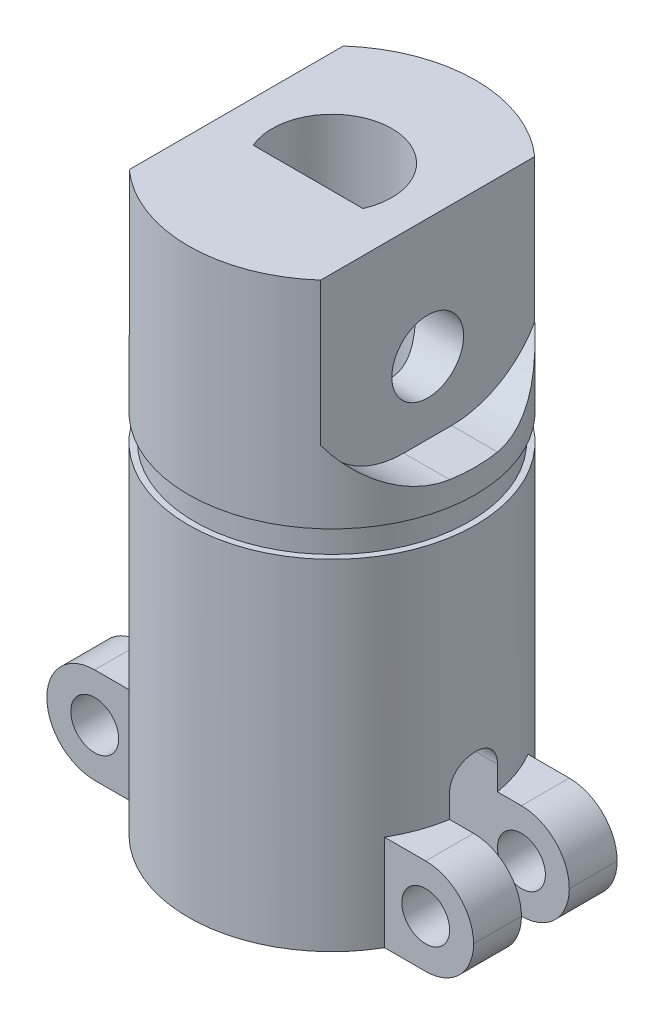
from build123d import *

# Parameters (mm, degrees)
CUT_EXTRUDE2_DEPTH  = 2
SKETCH4_R           = 1.5
CUT_EXTRUDE3_DEPTH  = 30.819624498
CUT_EXTRUDE4_DEPTH  = 27.804663864
CUT_EXTRUDE5_START  = -10
SKETCH6_R           = 8
SKETCH6_R_2         = 6
CUT_EXTRUDE5_DEPTH  = 10
CUT_EXTRUDE6_DEPTH  = 30.346379825
BOSS_EXTRUDE1_DEPTH = 4
SKETCH9_R           = 1
CUT_EXTRUDE7_DEPTH  = 30.012178231
FILLET1_R           = 2


with BuildPart() as part:
    # Sketch2 → Revolve1 (revolve)
    with BuildSketch(Plane.XY, mode=Mode.PRIVATE) as revolve1_sk:
        Polygon((0, 26.1), (-6, 26.1), (-6, 17.1), (-5.75, 17.1), (-5.75, 16), (-6, 16), (-6, 4), (-8, 4), (-8, 0), (-7, 0), (-7, 1.8), (0, 1.8), align=None)
    revolve(revolve1_sk.sketch.rotate(Axis((0, 0, 0), (0, 1, 0)), 270), axis=Axis((0, 0, 0), (0, 1, 0)))

    # Sketch3 → Cut-Extrude2 (cut)
    with BuildSketch(Plane.ZY.offset(6)):
        with BuildLine():
            Line((9, 26.1), (-9, 26.1))
            ThreePointArc((-9, 26.1), (-6.171572875, 24.928427125), (-5, 22.1))
            ThreePointArc((-5, 22.1), (-3.828427125, 19.271572875), (-1, 18.1))
            Line((-1, 18.1), (1, 18.1))
            ThreePointArc((1, 18.1), (3.828427125, 19.271572875), (5, 22.1))
            ThreePointArc((5, 22.1), (6.171572875, 24.928427125), (9, 26.1))
        make_face()
    cut_extrude2 = extrude(amount=-CUT_EXTRUDE2_DEPTH, mode=Mode.SUBTRACT)

    # Mirror1: Cut-Extrude2 across plane
    add(cut_extrude2.mirror(Plane(origin=(0, 0, 0), x_dir=(0, 0, 1), z_dir=(1, 0, 0))), mode=Mode.SUBTRACT)

    # Sketch4 → Cut-Extrude3 (cut, through all)
    with BuildSketch(Plane.ZY.offset(4)):
        with Locations((0, 21.1)):
            Circle(SKETCH4_R)
    extrude(amount=-CUT_EXTRUDE3_DEPTH, mode=Mode.SUBTRACT)

    # Sketch5 → Cut-Extrude4 (cut, through all)
    with BuildSketch(Plane.XZ.offset(-1.8)):
        with BuildLine():
            Line((2.291287847, 1), (-2.291287847, 1))
            ThreePointArc((-2.291287847, 1), (-0.510774109, -2.447265782), (2.5, 0))
            ThreePointArc((2.5, 0), (2.447265782, 0.510774109), (2.291287847, 1))
        make_face()
    extrude(amount=-CUT_EXTRUDE4_DEPTH, mode=Mode.SUBTRACT)

    # Sketch6 → Cut-Extrude5 (cut)
    with BuildSketch(Plane(origin=(0, 4, 0), x_dir=(1, 0, 0), z_dir=(0, 1, 0)).offset(CUT_EXTRUDE5_START)):
        Circle(SKETCH6_R)
        with Locations(Location((0, 0, 0), (0, 0, 90))):
            Circle(SKETCH6_R_2, mode=Mode.SUBTRACT)
    extrude(amount=CUT_EXTRUDE5_DEPTH, mode=Mode.SUBTRACT)

    # Sketch7 → Cut-Extrude6 (cut, through all)
    with BuildSketch(Plane(origin=(6, 0, 0), x_dir=(0, 0, -1), z_dir=(1, 0, 0))):
        with BuildLine():
            Line((-1, 1.8), (-1, 6.8))
            ThreePointArc((-1, 6.8), (0, 7.8), (1, 6.8))
            Line((1, 6.8), (1, 1.8))
            Line((1, 1.8), (-1, 1.8))
        make_face()
    extrude(amount=-CUT_EXTRUDE6_DEPTH, mode=Mode.SUBTRACT)

    # Sketch8 → Boss-Extrude1 (add)
    with BuildSketch(Plane.XZ.offset(-1.8)):
        with BuildLine():
            Line((-8.916079783, -3), (-5.196152423, -3))
            ThreePointArc((-5.196152423, -3), (-5.645389814, -2.032135293), (-5.916079783, -1))
            Line((-5.916079783, -1), (-8.916079783, -1))
            Line((-8.916079783, -1), (-8.916079783, -3))
        make_face()
        with BuildLine():
            ThreePointArc((-5.916079783, 1), (-5.645389814, 2.032135293), (-5.196152423, 3))
            Line((-5.196152423, 3), (-8.916079783, 3))
            Line((-8.916079783, 3), (-8.916079783, 1))
            Line((-8.916079783, 1), (-5.916079783, 1))
        make_face()
        with BuildLine():
            ThreePointArc((5.196152423, 3), (5.645389814, 2.032135293), (5.916079783, 1))
            Line((5.916079783, 1), (8.916079783, 1))
            Line((8.916079783, 1), (8.916079783, 3))
            Line((8.916079783, 3), (5.196152423, 3))
        make_face()
        with BuildLine():
            ThreePointArc((5.196152423, -3), (5.645389814, -2.032135293), (5.916079783, -1))
            Line((5.916079783, -1), (8.916079783, -1))
            Line((8.916079783, -1), (8.916079783, -3))
            Line((8.916079783, -3), (5.196152423, -3))
        make_face()
    extrude(amount=-BOSS_EXTRUDE1_DEPTH)

    # Sketch9 → Cut-Extrude7 (cut, through all)
    with BuildSketch(Plane(origin=(0, 0, -3), x_dir=(-1, 0, 0), z_dir=(0, 0, -1))):
        with Locations((-6.916079783, 3.8)):
            Circle(SKETCH9_R)
        with Locations((6.916079783, 3.8)):
            Circle(SKETCH9_R)
    extrude(amount=-CUT_EXTRUDE7_DEPTH, mode=Mode.SUBTRACT)

    # Fillet1
    fillet1_edges = [part.edges().sort_by_distance(p)[0] for p in [
        (-8.916079783, 5.8, 2),
        (-8.916079783, 1.8, 2),
        (-8.916079783, 1.8, -2),
        (-8.916079783, 5.8, -2),
        (8.916079783, 1.8, 2),
        (8.916079783, 5.8, 2),
        (8.916079783, 1.8, -2),
        (8.916079783, 5.8, -2),
    ]]
    fillet(fillet1_edges, radius=FILLET1_R - 0.0001)  # a hair under: the kernel refuses the full size


solid = part.part
